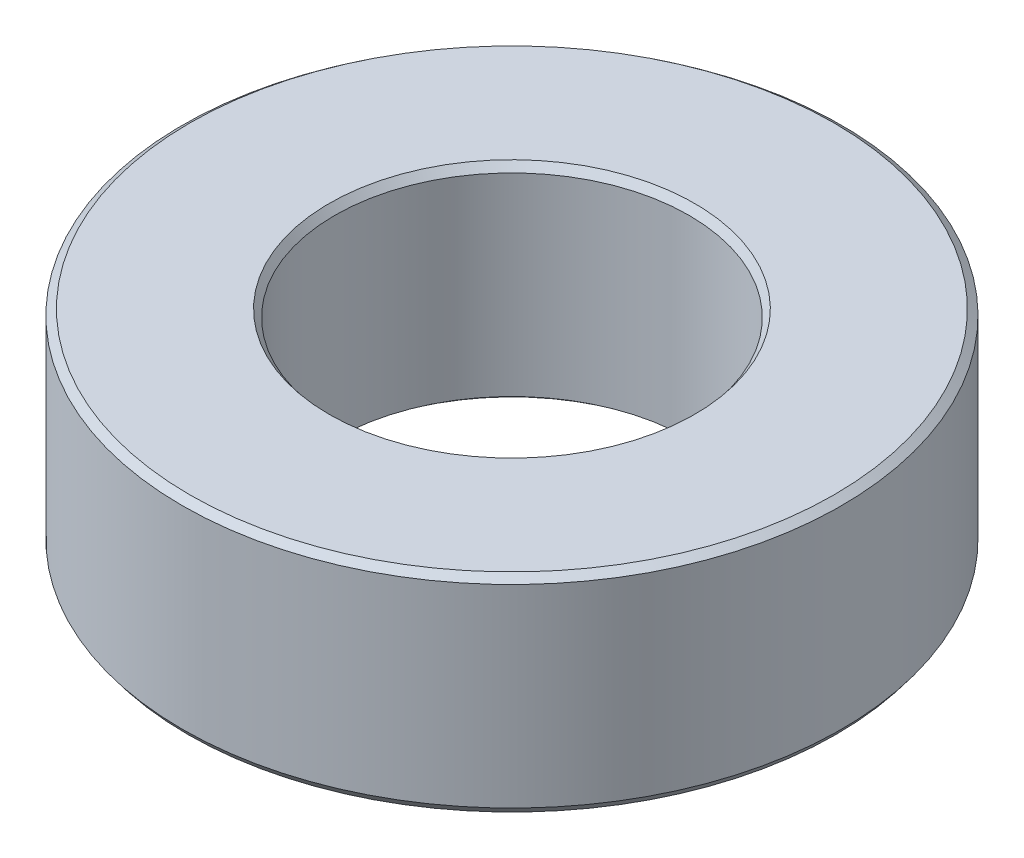
from build123d import *
from OCP.BRepFilletAPI import BRepFilletAPI_MakeChamfer

# Parameters (mm, degrees)
SKETCH1_R           = 57.5
BOSS_EXTRUDE1_DEPTH = 36.068350914
SKETCH2_R           = 30.896954254
CUT_EXTRUDE1_DEPTH  = 89.957438911
CHAMFER1_SIZE       = 0.987118094
CHAMFER1_SIZE2      = 1.30334208


with BuildPart() as part:
    # Sketch1 → Boss-Extrude1 (new body)
    with BuildSketch(Plane(origin=(0, 0, 0), x_dir=(1, 0, 0), z_dir=(0, 1, 0))):
        Circle(SKETCH1_R)
    extrude(amount=BOSS_EXTRUDE1_DEPTH)

    # Sketch2 → Cut-Extrude1 (cut, through all)
    with BuildSketch(Plane(origin=(0, 0, 0), x_dir=(1, 0, 0), z_dir=(0, 1, 0))):
        Circle(SKETCH2_R)
    extrude(amount=CUT_EXTRUDE1_DEPTH, mode=Mode.SUBTRACT)

    # Chamfer1: one chamfer whose edges measure the first distance from different faces: ONE call of the kernel's chamfer builder (chamfer() names one face for all edges)
    chamfer1_edges_1 = [part.edges().sort_by_distance(p)[0] for p in [
        (-30.896954254, 36.068350914, 0),
    ]]
    chamfer1_side_1 = [part.faces().sort_by_distance(p)[0] for p in [
        (-55.873654403, 36.068350914, 0),
    ]]
    chamfer1_edges_2 = [part.edges().sort_by_distance(p)[0] for p in [
        (-30.896954254, 0, 0),
    ]]
    chamfer1_side_2 = [part.faces().sort_by_distance(p)[0] for p in [
        (-30.896954254, 18.034175457, 0),
    ]]
    chamfer1_edges_3 = [part.edges().sort_by_distance(p)[0] for p in [
        (-57.5, 0, 0),
    ]]
    chamfer1_side_3 = [part.faces().sort_by_distance(p)[0] for p in [
        (-55.873654403, 0, 0),
    ]]
    chamfer1_edges_4 = [part.edges().sort_by_distance(p)[0] for p in [
        (-57.5, 36.068350914, 0),
    ]]
    chamfer1_side_4 = [part.faces().sort_by_distance(p)[0] for p in [
        (-57.5, 18.034175457, 0),
    ]]
    chamfer1 = BRepFilletAPI_MakeChamfer(part.part.solid().wrapped)
    for e in chamfer1_edges_1:
        chamfer1.Add(CHAMFER1_SIZE, CHAMFER1_SIZE2, e.wrapped, chamfer1_side_1[0].wrapped)  # the first distance lies on this face
    for e in chamfer1_edges_2:
        chamfer1.Add(CHAMFER1_SIZE, CHAMFER1_SIZE2, e.wrapped, chamfer1_side_2[0].wrapped)  # the first distance lies on this face
    for e in chamfer1_edges_3:
        chamfer1.Add(CHAMFER1_SIZE, CHAMFER1_SIZE2, e.wrapped, chamfer1_side_3[0].wrapped)  # the first distance lies on this face
    for e in chamfer1_edges_4:
        chamfer1.Add(CHAMFER1_SIZE, CHAMFER1_SIZE2, e.wrapped, chamfer1_side_4[0].wrapped)  # the first distance lies on this face
    add(Compound.cast(chamfer1.Shape()), mode=Mode.REPLACE)


solid = part.part
